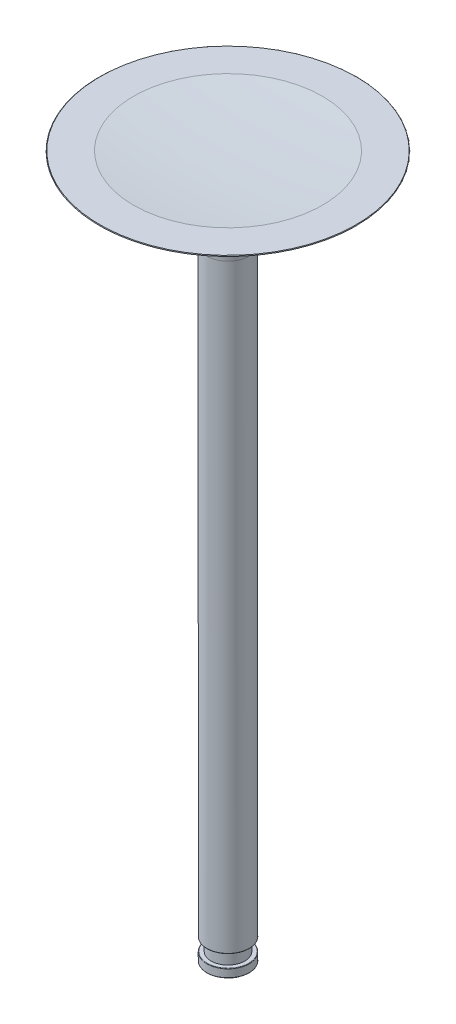
from build123d import *

# Parameters (mm, degrees)
FILLET1_R = 0.05


# Read off the part's stored shape, not the designer's step: Dome1
with BuildPart() as part:
    # Sketch1 → Revolve1 (revolve)
    with BuildSketch(Plane.XY, mode=Mode.PRIVATE) as revolve1_sk:
        with BuildLine():
            Line((0, 0), (0, 83.312))
            Line((0, 83.312), (-15.5, 83.312))
            ThreePointArc((-15.5, 83.312), (-12.341842281, 82.316034739), (-9.108981634, 81.598734928))
            ThreePointArc((-9.108981634, 81.598734928), (-4.371046299, 78.862184261), (-2.5, 73.720596322))
            Line((-2.5, 73.720596322), (-2.5, 2.5))
            Line((-2.5, 2.5), (-2, 2.5))
            Line((-2, 2.5), (-2, 1))
            Line((-2, 1), (-2.5, 1))
            Line((-2.5, 1), (-2.5, 0))
            Line((-2.5, 0), (0, 0))
        make_face()
    revolve(revolve1_sk.sketch.rotate(Axis((0, 0, 0), (0, 1, 0)), 270), axis=Axis((0, 0, 0), (0, 1, 0)))

    # Fillet1
    fillet1_edges = [part.edges().sort_by_distance(p)[0] for p in [
        (0, 83.312, 15.5),
        (0, 0, 2.5),
        (0, 1, 2.5),
        (0, 2.5, 2.5),
    ]]
    fillet(fillet1_edges, radius=FILLET1_R)

    # Dome1 outline → Dome1 (revolve, cut)
    with BuildSketch(Plane.XY):
        with BuildLine():
            Line((0, 83.312000011), (0, 82.812))
            ThreePointArc((0, 82.812), (5.612208004, 82.937062075), (11.21327404, 83.312000011))
            Line((11.21327404, 83.312000011), (0, 83.312000011))
        make_face()
    revolve(axis=Axis((0, 0, 0), (0, 1, 0)), mode=Mode.SUBTRACT)


solid = part.part
